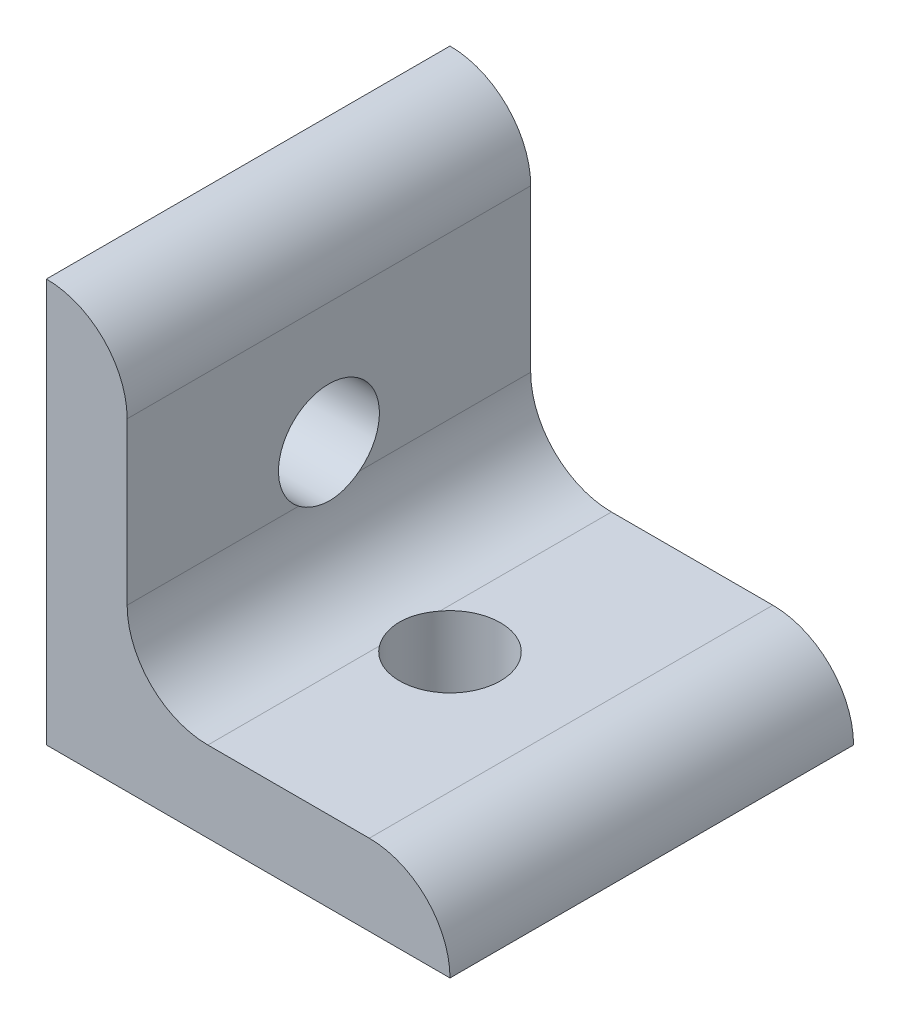
from build123d import *

# Parameters (mm, degrees)
BOSS_EXTRUDE1_DEPTH = 25.4
FILLET1_R           = 5.08
CUT_EXTRUDE1_DEPTH  = 25.4
CUT_EXTRUDE2_DEPTH  = 25.4


with BuildPart() as part:
    # Sketch1 → Boss-Extrude1 (new body)
    with BuildSketch(Plane.XY):
        Polygon((0, 0), (0, -25.4), (25.4, -25.4), (25.4, -20.32), (5.08, -20.32), (5.08, 0), align=None)
    extrude(amount=BOSS_EXTRUDE1_DEPTH)

    # Fillet1
    fillet1_edges = [part.edges().sort_by_distance(p)[0] for p in [
        (5.08, -20.32, 12.7),
        (5.08, 0, 12.7),
        (25.4, -20.32, 12.7),
    ]]
    fillet(fillet1_edges, radius=FILLET1_R - 0.0001)  # a hair under: the kernel refuses the full size

    # Sketch2 → Cut-Extrude1 (cut)
    with BuildSketch(Plane.XZ.offset(25.4)):
        with BuildLine():
            ThreePointArc((15.875, 12.7), (13.915019898, 15.633317516), (10.45493597, 14.94506403))
            Line((10.45493597, 14.94506403), (14.94506403, 10.45493597))
            ThreePointArc((14.94506403, 10.45493597), (15.633317516, 11.484980102), (15.875, 12.7))
        make_face()
        with BuildLine():
            Line((14.94506403, 10.45493597), (10.45493597, 14.94506403))
            ThreePointArc((10.45493597, 14.94506403), (10.45493597, 10.45493597), (14.94506403, 10.45493597))
        make_face()
    extrude(amount=-CUT_EXTRUDE1_DEPTH, mode=Mode.SUBTRACT)

    # Sketch3 → Cut-Extrude2 (cut)
    with BuildSketch(Plane.ZY):
        with BuildLine():
            ThreePointArc((10.45493597, -10.45493597), (10.45493597, -14.94506403), (14.94506403, -14.94506403))
            Line((14.94506403, -14.94506403), (10.45493597, -10.45493597))
        make_face()
        with BuildLine():
            Line((10.45493597, -10.45493597), (14.94506403, -14.94506403))
            ThreePointArc((14.94506403, -14.94506403), (15.633317516, -13.915019898), (15.875, -12.7))
            ThreePointArc((15.875, -12.7), (13.915019898, -9.766682484), (10.45493597, -10.45493597))
        make_face()
    extrude(amount=-CUT_EXTRUDE2_DEPTH, mode=Mode.SUBTRACT)


solid = part.part
